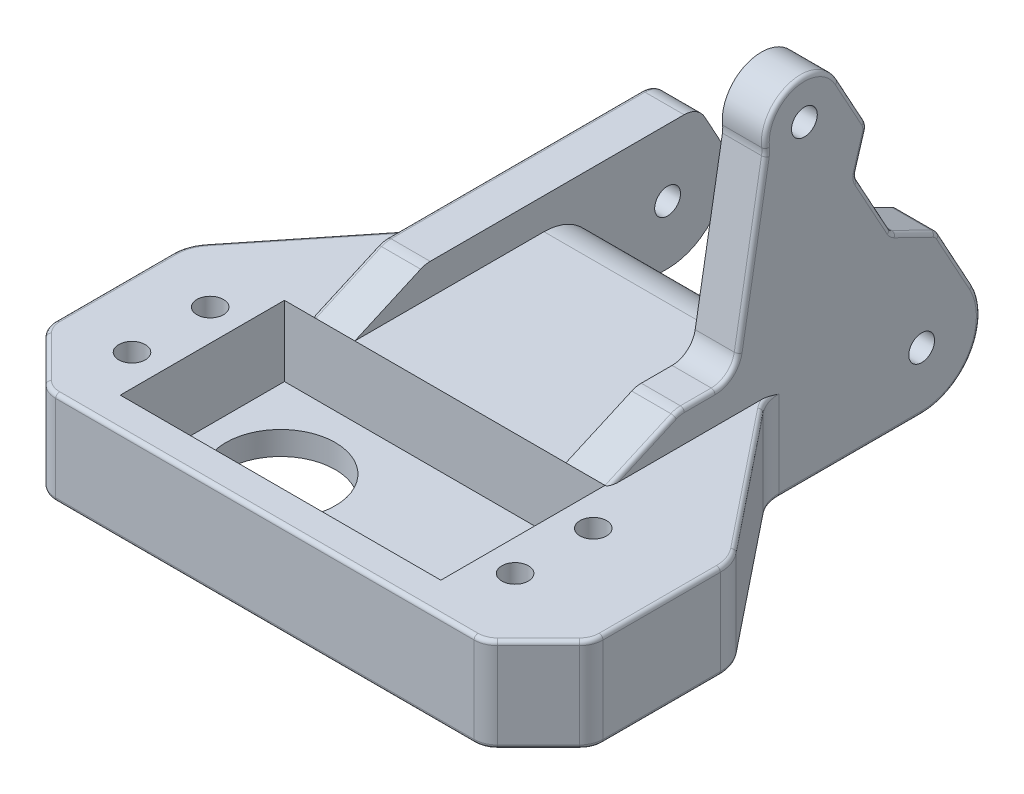
from build123d import *

# Parameters (mm, degrees)
SKETCH1_R           = 7.5
SKETCH1_R_2         = 1.65
SKETCH1_R_3         = 5
BOSS_EXTRUDE1_DEPTH = 2.75
CUT_EXTRUDE1_DEPTH  = 10
FILLET3_R           = 1.5
EXTRUDE_1_DEPTH     = 27
SKETCH_4_R          = 1.65
EXTRUDE_2_DEPTH     = 5.5
FILLET_1_R          = 3
EXTRUDE_3_DEPTH     = 12
SKETCH_6_R          = 1.65
SKETCH_6_R_2        = 7
CUT_EXTRUDE_1_DEPTH = 10
SKETCH_7_R          = 1.7
SKETCH_7_W          = 41
SKETCH_7_H          = 21
CUT_EXTRUDE_2_DEPTH = 9
SKETCH_9_R          = 3
CUT_EXTRUDE_3_DEPTH = 1.5
SKETCH_11_R         = 3.5
CUT_EXTRUDE_4_DEPTH = 5
FILLET_2_R          = 5
CHAMFER_1_SIZE      = 7
FILLET_3_R          = 3
FILLET_4_R          = 0.5


with BuildPart() as part:
    # Sketch1 → Boss-Extrude1 (new, symmetric)
    # profile 1 of 3: a face of its own
    with BuildSketch(Plane(origin=(0, 0, 0), x_dir=(0, 0, -1), z_dir=(1, 0, 0))):
        with BuildLine():
            Line((-40, -7.5), (0, -7.5))
            ThreePointArc((0, -7.5), (-6.454902502, 3.818930961), (6.573553871, 3.610871017))
            Line((6.573553871, 3.610871017), (-10.617630753, 34.907247345))
            ThreePointArc((-10.617630753, 34.907247345), (-10.15686846, 33.742608901), (-10, 32.5))
            ThreePointArc((-10, 32.5), (-14.49745519, 27.525319235), (-19.898979486, 31.5))
            Line((-19.898979486, 31.5), (-23.898979486, 8.5))
            Line((-23.898979486, 8.5), (-31, 8.5))
            Line((-31, 8.5), (-40, 4.5))
            Line((-40, 4.5), (-40, -7.5))
        make_face()
    # profile 2 of 3: a face of its own
    with BuildSketch(Plane(origin=(0, 0, 0), x_dir=(0, 0, -1), z_dir=(1, 0, 0))):
        Circle(SKETCH1_R)
        Circle(SKETCH1_R_2, mode=Mode.SUBTRACT)
    # profile 3 of 3: a face of its own
    with BuildSketch(Plane(origin=(0, 0, 0), x_dir=(0, 0, -1), z_dir=(1, 0, 0))):
        with Locations((-15, 32.5)):
            Circle(SKETCH1_R_3)
        with Locations((-15, 32.5)):
            Circle(SKETCH1_R_2, mode=Mode.SUBTRACT)
    extrude(amount=BOSS_EXTRUDE1_DEPTH, both=True)

    # Sketch2 → Cut-Extrude1 (cut)
    with BuildSketch(Plane(origin=(2.75, 0, 0), x_dir=(0, 0, -1), z_dir=(1, 0, 0))):
        Polygon((2.102708187, 11.75), (-3.740175524, 14.597930816), (-8.423675042, 23.124193935), (-6.90585641, 28.15), align=None)
    extrude(amount=-CUT_EXTRUDE1_DEPTH, mode=Mode.SUBTRACT)

    # Fillet3
    fillet3_edges = [part.edges().sort_by_distance(p)[0] for p in [
        (0, 28.15, 6.90585641),
        (0, 11.75, -2.102708187),
        (0, 14.597930816, 3.740175524),
        (0, 23.124193935, 8.423675042),
    ]]
    fillet(fillet3_edges, radius=FILLET3_R)

    # 草图2 → 凸台-拉伸1 (add)
    with BuildSketch(Plane.ZY.offset(2.75)):
        with BuildLine():
            Line((40, -7.5), (4.974937186, -7.5))
            ThreePointArc((4.974937186, -7.5), (7.572239412, -4.864276954), (8.889457854, -1.40625))
            ThreePointArc((8.889457854, -1.40625), (11.256847259, 2.822417214), (15.803480629, 4.5))
            Line((15.803480629, 4.5), (40, 4.5))
            Line((40, 4.5), (40, -7.5))
        make_face()
    extrude(amount=EXTRUDE_1_DEPTH)

    # 草图4 → 凸台-拉伸2 (add)
    with BuildSketch(Plane.ZY.offset(29.75)):
        with BuildLine():
            Line((31, 8.5), (-3.887942025, 8.5))
            Line((-3.887942025, 8.5), (-6.573553871, 3.610871017))
            ThreePointArc((-6.573553871, 3.610871017), (-6.454902502, -3.818930961), (0, -7.5))
            Line((0, -7.5), (40, -7.5))
            Line((40, -7.5), (40, 4.5))
            Line((40, 4.5), (31, 8.5))
        make_face()
        with Locations(Location((0, 0, 0), (0, 0, 180))):
            Circle(SKETCH_4_R, mode=Mode.SUBTRACT)
    extrude(amount=EXTRUDE_2_DEPTH)

    # 圆角1
    fillet_1_edges = [part.edges().sort_by_distance(p)[0] for p in [
        (-32.5, 8.5, 31),
        (-32.5, 8.5, -3.887942025),
        (0, 8.5, 31),
        (0, 8.5, 23.898979486),
        (0, 31.5, 19.898979486),
    ]]
    fillet(fillet_1_edges, radius=FILLET_1_R)

    # 草图5 → 凸台-拉伸3 (add)
    with BuildSketch(Plane.XZ.offset(7.5)):
        Polygon((2.75, 20), (18.75, 40), (18.75, 65), (-51.25, 65), (-51.25, 40), (-35.25, 20), align=None)
    extrude(amount=-EXTRUDE_3_DEPTH)

    # 草图6 → 切除-拉伸1 (cut)
    with BuildSketch(Plane.XZ.offset(7.5)):
        with Locations(Location((-3.75, 50.5, 0), (0, 0, 270))):
            Circle(SKETCH_6_R)
        with Locations(Location((-28.75, 50.5, 0), (0, 0, 270))):
            Circle(SKETCH_6_R_2)
    extrude(amount=-CUT_EXTRUDE_1_DEPTH, mode=Mode.SUBTRACT)

    # 草图7 → 切除-拉伸2 (cut)
    with BuildSketch(Plane(origin=(0, 4.5, 0), x_dir=(1, 0, 0), z_dir=(0, 1, 0))):
        with Locations(Location((-42.75, -45.5, 0), (0, 0, 270))):
            Circle(SKETCH_7_R)
        with Locations(Location((-42.75, -55.5, 0), (0, 0, 270))):
            Circle(SKETCH_7_R)
        with Locations(Location((6.25, -45.5, 0), (0, 0, 270))):
            Circle(SKETCH_7_R)
        with Locations(Location((6.25, -55.5, 0), (0, 0, 270))):
            Circle(SKETCH_7_R)
        with Locations((-18.25, -50.5)):
            Rectangle(SKETCH_7_W, SKETCH_7_H)
    extrude(amount=-CUT_EXTRUDE_2_DEPTH, mode=Mode.SUBTRACT)

    # 草图9 → 切除-拉伸3 (cut)
    with BuildSketch(Plane(origin=(0, -4.5, 0), x_dir=(1, 0, 0), z_dir=(0, 1, 0))):
        with Locations(Location((-3.75, -50.5, 0), (0, 0, 270))):
            Circle(SKETCH_9_R)
    extrude(amount=-CUT_EXTRUDE_3_DEPTH, mode=Mode.SUBTRACT)

    # 草图11 → 切除-拉伸4 (cut)
    with BuildSketch(Plane.XZ.offset(7.5)):
        with Locations(Location((-42.75, 55.5, 0), (0, 0, 270))):
            Circle(SKETCH_11_R)
        with Locations(Location((-42.75, 45.5, 0), (0, 0, 270))):
            Circle(SKETCH_11_R)
        with Locations(Location((6.25, 55.5, 0), (0, 0, 270))):
            Circle(SKETCH_11_R)
        with Locations(Location((6.25, 45.5, 0), (0, 0, 270))):
            Circle(SKETCH_11_R)
    extrude(amount=-CUT_EXTRUDE_4_DEPTH, mode=Mode.SUBTRACT)

    # 圆角2
    fillet_2_edges = [part.edges().sort_by_distance(p)[0] for p in [
        (2.75, -1.5, 20),
        (-35.25, -1.5, 20),
        (-51.25, -1.5, 40),
        (18.75, -1.5, 40),
    ]]
    fillet(fillet_2_edges, radius=FILLET_2_R)

    # 倒角1
    chamfer_1_edges = [part.edges().sort_by_distance(p)[0] for p in [
        (-51.25, -1.5, 65),
        (18.75, -1.5, 65),
    ]]
    chamfer(chamfer_1_edges, length=CHAMFER_1_SIZE)

    # 圆角3
    fillet_3_edges = [part.edges().sort_by_distance(p)[0] for p in [
        (18.75, -1.5, 58),
        (-44.25, -1.5, 65),
        (11.75, -1.5, 65),
        (-51.25, -1.5, 58),
    ]]
    fillet(fillet_3_edges, radius=FILLET_3_R)

    # 圆角4
    # the kernel refuses this fillet: 0.5 mm, written as the material it takes off along each edge
    with BuildSketch(Plane(origin=(2.75, 32.5, 15), x_dir=(0, 0.4814494689878742, -0.8764738494737273), z_dir=(0, -0.8764738494737273, -0.4814494689878742))) as fillet_4_piece_1:
        with BuildLine():
            CenterArc((5 - FILLET_4_R, -FILLET_4_R), FILLET_4_R, 0, 90)
            Line((5, -FILLET_4_R), (5, 0))
            Line((5, 0), (5 - FILLET_4_R, 0))
        make_face()
    revolve(axis=Axis((2.75, 32.5, 15), (1, 0, 0)), revolution_arc=158.23726256, mode=Mode.SUBTRACT)
    with BuildSketch(Plane(origin=(-35.25, 8.5, 30.363356649), x_dir=(0, -1, 0), z_dir=(0, 0, -1))) as fillet_4_piece_2:
        with BuildLine():
            CenterArc((FILLET_4_R, -FILLET_4_R), FILLET_4_R, 90, 90)
            Line((0, -FILLET_4_R), (0, 0))
            Line((0, 0), (FILLET_4_R, 0))
        make_face()
    extrude(amount=32.476400776, mode=Mode.SUBTRACT)
    with BuildSketch(Plane(origin=(-35.25, 6.944348407, -4.742465676), x_dir=(0, -0.48144946898787383, 0.8764738494737276), z_dir=(0, -0.8764738494737275, -0.4814494689878738))) as fillet_4_piece_3:
        with BuildLine():
            CenterArc((FILLET_4_R, -FILLET_4_R), FILLET_4_R, 90, 90)
            Line((0, -FILLET_4_R), (0, 0))
            Line((0, 0), (FILLET_4_R, 0))
        make_face()
    extrude(amount=3.803282199, mode=Mode.SUBTRACT)
    with BuildSketch(Plane(origin=(-35.25, 5.5, -2.113044128), x_dir=(0, 1, 0), z_dir=(0, 0, 1))) as fillet_4_piece_4:
        with BuildLine():
            CenterArc((3 - FILLET_4_R, -FILLET_4_R), FILLET_4_R, 0, 90)
            Line((3, -FILLET_4_R), (3, 0))
            Line((3, 0), (3 - FILLET_4_R, 0))
        make_face()
    revolve(axis=Axis((-35.25, 5.5, -2.113044128), (-1, 0, 0)), revolution_arc=61.219888022, mode=Mode.SUBTRACT)
    with BuildSketch(Plane(origin=(-35.25, 5.5, 30.363356649), x_dir=(0, 1, 0), z_dir=(0, 0, -1))) as fillet_4_piece_5:
        with BuildLine():
            CenterArc((3 - FILLET_4_R, FILLET_4_R), FILLET_4_R, 270, 90)
            Line((3, FILLET_4_R), (3, 0))
            Line((3, 0), (3 - FILLET_4_R, 0))
        make_face()
    revolve(axis=Axis((-35.25, 5.5, 30.363356649), (1, 0, 0)), revolution_arc=23.962488975, mode=Mode.SUBTRACT)
    with BuildSketch(Plane(origin=(2.75, 8.5, 26.422271015), x_dir=(0, -1, 0), z_dir=(0, 0, 1))) as fillet_4_piece_6:
        with BuildLine():
            CenterArc((FILLET_4_R, -FILLET_4_R), FILLET_4_R, 90, 90)
            Line((0, -FILLET_4_R), (0, 0))
            Line((0, 0), (FILLET_4_R, 0))
        make_face()
    extrude(amount=3.941085634, mode=Mode.SUBTRACT)
    with BuildSketch(Plane(origin=(2.75, 31.008613913, 19.984437936), x_dir=(0, -0.1713411747512476, -0.9852117548196746), z_dir=(0, -0.9852117548196746, 0.17134117475124758))) as fillet_4_piece_7:
        with BuildLine():
            CenterArc((FILLET_4_R, -FILLET_4_R), FILLET_4_R, 90, 90)
            Line((0, -FILLET_4_R), (0, 0))
            Line((0, 0), (FILLET_4_R, 0))
        make_face()
    extrude(amount=20.32318163, mode=Mode.SUBTRACT)
    with BuildSketch(Plane(origin=(2.75, 5.5, 30.363356649), x_dir=(0, 0.9138115486202572, 0.4061384660534475), z_dir=(0, -0.4061384660534475, 0.9138115486202572))) as fillet_4_piece_8:
        with BuildLine():
            CenterArc((3 - FILLET_4_R, FILLET_4_R), FILLET_4_R, 270, 90)
            Line((3, FILLET_4_R), (3, 0))
            Line((3, 0), (3 - FILLET_4_R, 0))
        make_face()
    revolve(axis=Axis((2.75, 5.5, 30.363356649), (-1, 0, 0)), revolution_arc=23.962488975, mode=Mode.SUBTRACT)
    with BuildSketch(Plane(origin=(2.75, 11.5, 26.422271015), x_dir=(0, -1, 0), z_dir=(0, 0, 1))) as fillet_4_piece_9:
        with BuildLine():
            CenterArc((3 + FILLET_4_R, -FILLET_4_R), FILLET_4_R, 90, 90)
            Line((3, -FILLET_4_R), (3, 0))
            Line((3, 0), (3 + FILLET_4_R, 0))
        make_face()
    revolve(axis=Axis((2.75, 11.5, 26.422271015), (1, 0, 0)), revolution_arc=80.134193057, mode=Mode.SUBTRACT)
    with BuildSketch(Plane(origin=(2.75, 31.522637437, 22.9400732), x_dir=(0, -0.17134117475124813, -0.9852117548196744), z_dir=(0, -0.9852117548196744, 0.17134117475124813))) as fillet_4_piece_10:
        with BuildLine():
            CenterArc((3 + FILLET_4_R, -FILLET_4_R), FILLET_4_R, 90, 90)
            Line((3, -FILLET_4_R), (3, 0))
            Line((3, 0), (3 + FILLET_4_R, 0))
        make_face()
    revolve(axis=Axis((2.75, 31.522637437, 22.9400732), (1, 0, 0)), revolution_arc=16.883181481, mode=Mode.SUBTRACT)
    with BuildSketch(Plane(origin=(2.75, 8.241434646, 31.581772047), x_dir=(0, -0.9138115486202573, -0.40613846605344783), z_dir=(0, -0.4061384660534478, 0.913811548620257))) as fillet_4_piece_11_section:
        with BuildLine():
            CenterArc((FILLET_4_R, -FILLET_4_R), FILLET_4_R, 90, 90)
            Line((0, -FILLET_4_R), (0, 0))
            Line((0, 0), (FILLET_4_R, 0))
        make_face()
    fillet_4_piece_11 = extrude(amount=10.46221445, mode=Mode.PRIVATE)
    fillet_4_piece_11 = split(fillet_4_piece_11, bisect_by=Plane(origin=(2.665903112, 4.5, 31.925842247), z_dir=(0, 1, 0)), keep=Keep.TOP, mode=Mode.PRIVATE)
    add(fillet_4_piece_11, mode=Mode.SUBTRACT)
    with BuildSketch(Plane(origin=(3.845655953, 4.5, 21.369569941), x_dir=(-0.7808688094430303, 0, 0.6246950475544245), z_dir=(0.6246950475544245, 0, 0.7808688094430303)), Plane(origin=(-50.154344047, 4.5, 38.630430059), x_dir=(0.7808688094430304, 0, 0.6246950475544243), z_dir=(0.6246950475544243, 0, -0.7808688094430304))) as fillet_4_piece_12:
        with BuildLine():
            CenterArc((FILLET_4_R, FILLET_4_R), FILLET_4_R, 180, 90)
            Line((0, FILLET_4_R), (0, 0))
            Line((0, 0), (FILLET_4_R, 0))
        make_face()
    extrude(amount=22.104686356, mode=Mode.SUBTRACT)
    with BuildSketch(Plane(origin=(3.845655953, -7.5, 21.369569941), x_dir=(-0.7808688094430302, 0, 0.6246950475544245), z_dir=(0.6246950475544245, 0, 0.7808688094430303)), Plane(origin=(-50.154344047, -7.5, 38.630430059), x_dir=(0.7808688094430304, 0, 0.6246950475544243), z_dir=(0.6246950475544243, 0, -0.7808688094430304))) as fillet_4_piece_13:
        with BuildLine():
            CenterArc((FILLET_4_R, -FILLET_4_R), FILLET_4_R, 90, 90)
            Line((0, -FILLET_4_R), (0, 0))
            Line((0, 0), (FILLET_4_R, 0))
        make_face()
    extrude(amount=22.104686356, mode=Mode.SUBTRACT)
    with BuildSketch(Plane(origin=(18.75, -7.5, 41.753905297), x_dir=(-1, 0, 0), z_dir=(0, 0, 1)), Plane(origin=(-51.25, 4.5, 56.757359313), x_dir=(0, -1, 0), z_dir=(0, 0, -1))) as fillet_4_piece_14:
        with BuildLine():
            CenterArc((FILLET_4_R, -FILLET_4_R), FILLET_4_R, 90, 90)
            Line((0, -FILLET_4_R), (0, 0))
            Line((0, 0), (FILLET_4_R, 0))
        make_face()
    extrude(amount=15.003454016, mode=Mode.SUBTRACT)
    with BuildSketch(Plane(origin=(-46.25, -7.5, 41.753905297), x_dir=(-1, 0, 0), z_dir=(0, 0, 1))) as fillet_4_piece_15:
        with BuildLine():
            CenterArc((5 - FILLET_4_R, -FILLET_4_R), FILLET_4_R, 0, 90)
            Line((5, -FILLET_4_R), (5, 0))
            Line((5, 0), (5 - FILLET_4_R, 0))
        make_face()
    revolve(axis=Axis((-46.25, -7.5, 41.753905297), (0, -1, 0)), revolution_arc=38.659808254, mode=Mode.SUBTRACT)
    with BuildSketch(Plane(origin=(13.75, -7.5, 41.753905297), x_dir=(0.7808688094430305, 0, -0.6246950475544241), z_dir=(-0.6246950475544241, 0, -0.7808688094430305))) as fillet_4_piece_16:
        with BuildLine():
            CenterArc((5 - FILLET_4_R, -FILLET_4_R), FILLET_4_R, 360, 90)
            Line((5, -FILLET_4_R), (5, 0))
            Line((5, 0), (5 - FILLET_4_R, 0))
        make_face()
    revolve(axis=Axis((13.75, -7.5, 41.753905297), (0, -1, 0)), revolution_arc=38.659808254, mode=Mode.SUBTRACT)
    with BuildSketch(Plane(origin=(-46.25, 4.5, 41.753905297), x_dir=(-1, 0, 0), z_dir=(0, 0, 1))) as fillet_4_piece_17:
        with BuildLine():
            CenterArc((5 - FILLET_4_R, FILLET_4_R), FILLET_4_R, 270, 90)
            Line((5 - FILLET_4_R, 0), (5, 0))
            Line((5, 0), (5, FILLET_4_R))
        make_face()
    revolve(axis=Axis((-46.25, 4.5, 41.753905297), (0, -1, 0)), revolution_arc=38.659808254, mode=Mode.SUBTRACT)
    with BuildSketch(Plane(origin=(13.75, 4.5, 41.753905297), x_dir=(0.7808688094430307, 0, -0.6246950475544237), z_dir=(-0.6246950475544237, 0, -0.7808688094430307))) as fillet_4_piece_18:
        with BuildLine():
            CenterArc((5 - FILLET_4_R, FILLET_4_R), FILLET_4_R, 270, 90)
            Line((5, FILLET_4_R), (5, 0))
            Line((5, 0), (5 - FILLET_4_R, 0))
        make_face()
    revolve(axis=Axis((13.75, 4.5, 41.753905297), (0, -1, 0)), revolution_arc=38.659808254, mode=Mode.SUBTRACT)
    with BuildSketch(Plane(origin=(7.75, -7.5, 18.246094703), x_dir=(-1, 0, 0), z_dir=(0, 0, -1))) as fillet_4_piece_19:
        with BuildLine():
            CenterArc((5 + FILLET_4_R, FILLET_4_R), FILLET_4_R, 180, 90)
            Line((5, FILLET_4_R), (5, 0))
            Line((5, 0), (5 + FILLET_4_R, 0))
        make_face()
    revolve(axis=Axis((7.75, -7.5, 18.246094703), (0, 1, 0)), revolution_arc=38.659808254, mode=Mode.SUBTRACT)
    with BuildSketch(Plane(origin=(7.75, 4.5, 18.246094703), x_dir=(-0.968907838098559, 0, -0.2474219094404866), z_dir=(0.2474219094404866, 0, -0.968907838098559))) as fillet_4_piece_20_section:
        with BuildLine():
            CenterArc((5 + FILLET_4_R, -FILLET_4_R), FILLET_4_R, 90, 90)
            Line((5, -FILLET_4_R), (5, 0))
            Line((5, 0), (5 + FILLET_4_R, 0))
        make_face()
    fillet_4_piece_20 = revolve(axis=Axis((7.75, 4.5, 18.246094703), (0, 1, 0)), revolution_arc=52.984814603, mode=Mode.PRIVATE)
    fillet_4_piece_20 = split(fillet_4_piece_20, bisect_by=Plane(origin=(2.75, 4.355158309, 19.909083982), z_dir=(1, 0, 0)), keep=Keep.TOP, mode=Mode.PRIVATE)
    add(fillet_4_piece_20, mode=Mode.SUBTRACT)
    with BuildSketch(Plane(origin=(-40.25, -7.5, 18.246094703), x_dir=(0.7808688094430307, 0, 0.6246950475544237), z_dir=(-0.6246950475544237, 0, 0.7808688094430307))) as fillet_4_piece_21:
        with BuildLine():
            CenterArc((5 + FILLET_4_R, FILLET_4_R), FILLET_4_R, 180, 90)
            Line((5, FILLET_4_R), (5, 0))
            Line((5, 0), (5 + FILLET_4_R, 0))
        make_face()
    revolve(axis=Axis((-40.25, -7.5, 18.246094703), (0, 1, 0)), revolution_arc=38.659808254, mode=Mode.SUBTRACT)
    with BuildSketch(Plane(origin=(-40.25, 4.5, 18.246094703), x_dir=(0.7808688094430299, 0, 0.624695047554425), z_dir=(-0.624695047554425, 0, 0.7808688094430299))) as fillet_4_piece_22_section:
        with BuildLine():
            CenterArc((5 + FILLET_4_R, -FILLET_4_R), FILLET_4_R, 90, 90)
            Line((5, -FILLET_4_R), (5, 0))
            Line((5, 0), (5 + FILLET_4_R, 0))
        make_face()
    fillet_4_piece_22 = revolve(axis=Axis((-40.25, 4.5, 18.246094703), (0, 1, 0)), revolution_arc=52.984814603, mode=Mode.PRIVATE)
    fillet_4_piece_22 = split(fillet_4_piece_22, bisect_by=Plane(origin=(-35.25, 4.415764443, 20.981944608), z_dir=(-1, 0, 0)), keep=Keep.TOP, mode=Mode.PRIVATE)
    add(fillet_4_piece_22, mode=Mode.SUBTRACT)
    with BuildSketch(Plane(origin=(2.75, -7.5, 18.246094703), x_dir=(-1, 0, 0), z_dir=(0, 0, -1)), Plane(origin=(-35.25, -7.5, 0), x_dir=(1, 0, 0), z_dir=(0, 0, 1))) as fillet_4_piece_23:
        with BuildLine():
            CenterArc((FILLET_4_R, FILLET_4_R), FILLET_4_R, 180, 90)
            Line((0, FILLET_4_R), (0, 0))
            Line((0, 0), (FILLET_4_R, 0))
        make_face()
    extrude(amount=18.246094703, mode=Mode.SUBTRACT)
    with BuildSketch(Plane(origin=(-51.25, -7.5, 56.757359313), x_dir=(0, 1, 0), z_dir=(0, 0, -1)), Plane(origin=(18.75, 4.5, 41.753905297), x_dir=(-1, 0, 0), z_dir=(0, 0, 1))) as fillet_4_piece_24:
        with BuildLine():
            CenterArc((FILLET_4_R, FILLET_4_R), FILLET_4_R, 180, 90)
            Line((0, FILLET_4_R), (0, 0))
            Line((0, 0), (FILLET_4_R, 0))
        make_face()
    extrude(amount=15.003454016, mode=Mode.SUBTRACT)
    with BuildSketch(Plane(origin=(10.507359313, 4.5, 65), x_dir=(0, 0, -1), z_dir=(-1, 0, 0))) as fillet_4_piece_25:
        with BuildLine():
            CenterArc((FILLET_4_R, FILLET_4_R), FILLET_4_R, 180, 90)
            Line((0, FILLET_4_R), (0, 0))
            Line((0, 0), (FILLET_4_R, 0))
        make_face()
    extrude(amount=53.514718626, mode=Mode.SUBTRACT)
    with BuildSketch(Plane(origin=(12.628679656, 4.5, 64.121320344), x_dir=(-0.7071067811865474, 0, -0.7071067811865478), z_dir=(0.7071067811865478, 0, -0.7071067811865474)), Plane(origin=(-50.371320344, 4.5, 58.878679656), x_dir=(0.7071067811865476, -3.5527136788004725e-15, -0.7071067811865476), z_dir=(0.7071067811865476, 0, 0.7071067811865476))) as fillet_4_piece_26:
        with BuildLine():
            CenterArc((FILLET_4_R, -FILLET_4_R), FILLET_4_R, 90, 90)
            Line((0, -FILLET_4_R), (0, 0))
            Line((0, 0), (FILLET_4_R, 0))
        make_face()
    extrude(amount=7.414213562, mode=Mode.SUBTRACT)
    with BuildSketch(Plane(origin=(10.507359313, 4.5, 62), x_dir=(0.7071067811865476, 0, 0.7071067811865476), z_dir=(0.7071067811865476, 0, -0.7071067811865476))) as fillet_4_piece_27:
        with BuildLine():
            CenterArc((3 - FILLET_4_R, FILLET_4_R), FILLET_4_R, 270, 90)
            Line((3, FILLET_4_R), (3, 0))
            Line((3, 0), (3 - FILLET_4_R, 0))
        make_face()
    revolve(axis=Axis((10.507359313, 4.5, 62), (0, -1, 0)), revolution_arc=45, mode=Mode.SUBTRACT)
    with BuildSketch(Plane(origin=(15.75, 4.5, 56.757359313), x_dir=(1, 0, 0), z_dir=(0, 0, -1))) as fillet_4_piece_28:
        with BuildLine():
            CenterArc((3 - FILLET_4_R, FILLET_4_R), FILLET_4_R, 270, 90)
            Line((3, FILLET_4_R), (3, 0))
            Line((3, 0), (3 - FILLET_4_R, 0))
        make_face()
    revolve(axis=Axis((15.75, 4.5, 56.757359313), (0, -1, 0)), revolution_arc=45, mode=Mode.SUBTRACT)
    with BuildSketch(Plane(origin=(-43.007359313, 4.5, 62), x_dir=(-0.7071067811865464, 0, 0.7071067811865487), z_dir=(-0.7071067811865487, 0, -0.7071067811865464))) as fillet_4_piece_29:
        with BuildLine():
            CenterArc((3 - FILLET_4_R, -FILLET_4_R), FILLET_4_R, 0, 90)
            Line((3, -FILLET_4_R), (3, 0))
            Line((3, 0), (3 - FILLET_4_R, 0))
        make_face()
    revolve(axis=Axis((-43.007359313, 4.5, 62), (0, 1, 0)), revolution_arc=45, mode=Mode.SUBTRACT)
    with BuildSketch(Plane(origin=(-48.25, 4.5, 56.757359313), x_dir=(-1, 0, 0), z_dir=(0, 0, -1))) as fillet_4_piece_30:
        with BuildLine():
            CenterArc((3 - FILLET_4_R, -FILLET_4_R), FILLET_4_R, 0, 90)
            Line((3 - FILLET_4_R, 0), (3, 0))
            Line((3, 0), (3, -FILLET_4_R))
        make_face()
    revolve(axis=Axis((-48.25, 4.5, 56.757359313), (0, 1, 0)), revolution_arc=45, mode=Mode.SUBTRACT)
    with BuildSketch(Plane(origin=(-50.371320344, -7.5, 58.878679656), x_dir=(0.7071067811865476, 0, -0.7071067811865476), z_dir=(0.7071067811865476, 0, 0.7071067811865476)), Plane(origin=(12.628679656, -7.5, 64.121320344), x_dir=(-0.7071067811865472, 0, -0.7071067811865477), z_dir=(0.7071067811865478, 0, -0.7071067811865474))) as fillet_4_piece_31:
        with BuildLine():
            CenterArc((FILLET_4_R, FILLET_4_R), FILLET_4_R, 180, 90)
            Line((0, FILLET_4_R), (0, 0))
            Line((0, 0), (FILLET_4_R, 0))
        make_face()
    extrude(amount=7.414213562, mode=Mode.SUBTRACT)
    with BuildSketch(Plane(origin=(10.507359313, -7.5, 65), x_dir=(0, 0, -1), z_dir=(-1, 0, 0))) as fillet_4_piece_32:
        with BuildLine():
            CenterArc((FILLET_4_R, -FILLET_4_R), FILLET_4_R, 90, 90)
            Line((0, -FILLET_4_R), (0, 0))
            Line((0, 0), (FILLET_4_R, 0))
        make_face()
    extrude(amount=53.514718626, mode=Mode.SUBTRACT)
    with BuildSketch(Plane(origin=(10.507359313, -7.5, 62), x_dir=(0.707106781186547, 0, 0.7071067811865482), z_dir=(0.7071067811865482, 0, -0.707106781186547))) as fillet_4_piece_33:
        with BuildLine():
            CenterArc((3 - FILLET_4_R, -FILLET_4_R), FILLET_4_R, 0, 90)
            Line((3, -FILLET_4_R), (3, 0))
            Line((3, 0), (3 - FILLET_4_R, 0))
        make_face()
    revolve(axis=Axis((10.507359313, -7.5, 62), (0, -1, 0)), revolution_arc=45, mode=Mode.SUBTRACT)
    with BuildSketch(Plane(origin=(15.75, -7.5, 56.757359313), x_dir=(1, 0, 0), z_dir=(0, 0, -1))) as fillet_4_piece_34:
        with BuildLine():
            CenterArc((3 - FILLET_4_R, -FILLET_4_R), FILLET_4_R, 0, 90)
            Line((3, -FILLET_4_R), (3, 0))
            Line((3, 0), (3 - FILLET_4_R, 0))
        make_face()
    revolve(axis=Axis((15.75, -7.5, 56.757359313), (0, -1, 0)), revolution_arc=45, mode=Mode.SUBTRACT)
    with BuildSketch(Plane(origin=(-43.007359313, -7.5, 62), x_dir=(-0.7071067811865476, 0, 0.7071067811865476), z_dir=(-0.7071067811865476, 0, -0.7071067811865476))) as fillet_4_piece_35:
        with BuildLine():
            CenterArc((3 - FILLET_4_R, FILLET_4_R), FILLET_4_R, 270, 90)
            Line((3, FILLET_4_R), (3, 0))
            Line((3, 0), (3 - FILLET_4_R, 0))
        make_face()
    revolve(axis=Axis((-43.007359313, -7.5, 62), (0, 1, 0)), revolution_arc=45, mode=Mode.SUBTRACT)
    with BuildSketch(Plane(origin=(-48.25, -7.5, 56.757359313), x_dir=(-1, 0, 0), z_dir=(0, 0, -1))) as fillet_4_piece_36:
        with BuildLine():
            CenterArc((3 - FILLET_4_R, FILLET_4_R), FILLET_4_R, 270, 90)
            Line((3, FILLET_4_R), (3, 0))
            Line((3, 0), (3 - FILLET_4_R, 0))
        make_face()
    revolve(axis=Axis((-48.25, -7.5, 56.757359313), (0, 1, 0)), revolution_arc=45, mode=Mode.SUBTRACT)
    with BuildSketch(Plane(origin=(2.75, 0, 0), x_dir=(0, 0.4814494689878744, -0.8764738494737272), z_dir=(0, 0.8764738494737272, 0.4814494689878744))) as fillet_4_piece_37:
        with BuildLine():
            CenterArc((7.5 - FILLET_4_R, FILLET_4_R), FILLET_4_R, 270, 90)
            Line((7.5, FILLET_4_R), (7.5, 0))
            Line((7.5, 0), (7.5 - FILLET_4_R, 0))
        make_face()
    revolve(axis=Axis((2.75, 0, 0), (-1, 0, 0)), revolution_arc=118.780111978, mode=Mode.SUBTRACT)
    with BuildSketch(Plane(origin=(2.75, 3.610871017, -6.573553871), x_dir=(0, -0.4814494689878743, 0.8764738494737274), z_dir=(0, 0.8764738494737274, 0.4814494689878743))) as fillet_4_piece_38:
        with BuildLine():
            CenterArc((FILLET_4_R, -FILLET_4_R), FILLET_4_R, 90, 90)
            Line((0, -FILLET_4_R), (0, 0))
            Line((0, 0), (FILLET_4_R, 0))
        make_face()
    extrude(amount=8.809896049, mode=Mode.SUBTRACT)
    with BuildSketch(Plane(origin=(2.75, 11.958698097, -1.674538126), x_dir=(0, -0.8989051864283686, 0.43814320240325516), z_dir=(0, 0.43814320240325527, 0.8989051864283687))) as fillet_4_piece_39:
        with BuildLine():
            CenterArc((FILLET_4_R, -FILLET_4_R), FILLET_4_R, 90, 90)
            Line((0, -FILLET_4_R), (0, 0))
            Line((0, 0), (FILLET_4_R, 0))
        make_face()
    extrude(amount=5.547352116, mode=Mode.SUBTRACT)
    with BuildSketch(Plane(origin=(2.75, 15.015416295, 3.969501433), x_dir=(0, -0.48144946898787416, 0.8764738494737273), z_dir=(0, 0.8764738494737274, 0.4814494689878742))) as fillet_4_piece_40:
        with BuildLine():
            CenterArc((FILLET_4_R, -FILLET_4_R), FILLET_4_R, 90, 90)
            Line((0, -FILLET_4_R), (0, 0))
            Line((0, 0), (FILLET_4_R, 0))
        make_face()
    extrude(amount=8.621284918, mode=Mode.SUBTRACT)
    with BuildSketch(Plane(origin=(2.75, 23.727583743, 8.241448295), x_dir=(0, 0.28910831078003235, 0.957296393306648), z_dir=(0, 0.957296393306648, -0.2891083107800323))) as fillet_4_piece_41:
        with BuildLine():
            CenterArc((FILLET_4_R, -FILLET_4_R), FILLET_4_R, 90, 90)
            Line((0, -FILLET_4_R), (0, 0))
            Line((0, 0), (FILLET_4_R, 0))
        make_face()
    extrude(amount=3.989387691, mode=Mode.SUBTRACT)
    with BuildSketch(Plane(origin=(2.75, 27.980272658, 8.524027748), x_dir=(0, 0.48144946898787566, -0.8764738494737264), z_dir=(0, 0.8764738494737264, 0.48144946898787566))) as fillet_4_piece_42:
        with BuildLine():
            CenterArc((1.5 - FILLET_4_R, FILLET_4_R), FILLET_4_R, 270, 90)
            Line((1.5, FILLET_4_R), (1.5, 0))
            Line((1.5, 0), (1.5 - FILLET_4_R, 0))
        make_face()
    revolve(axis=Axis((2.75, 27.980272658, 8.524027748), (-1, 0, 0)), revolution_arc=45.584691403, mode=Mode.SUBTRACT)
    with BuildSketch(Plane(origin=(2.75, 10.610340318, -1.017323322), x_dir=(0, 0.4814494689878744, -0.8764738494737271), z_dir=(0, -0.8764738494737271, -0.4814494689878744))) as fillet_4_piece_43:
        with BuildLine():
            CenterArc((1.5 - FILLET_4_R, -FILLET_4_R), FILLET_4_R, 0, 90)
            Line((1.5, -FILLET_4_R), (1.5, 0))
            Line((1.5, 0), (1.5 - FILLET_4_R, 0))
        make_face()
    revolve(axis=Axis((2.75, 10.610340318, -1.017323322), (1, 0, 0)), revolution_arc=35.234417985, mode=Mode.SUBTRACT)
    with BuildSketch(Plane(origin=(2.75, 28.702446861, 7.209316974), x_dir=(0, -0.4814494689878742, 0.8764738494737274), z_dir=(0, 0.8764738494737274, 0.4814494689878743))) as fillet_4_piece_44:
        with BuildLine():
            CenterArc((FILLET_4_R, -FILLET_4_R), FILLET_4_R, 90, 90)
            Line((0, -FILLET_4_R), (0, 0))
            Line((0, 0), (FILLET_4_R, 0))
        make_face()
    extrude(amount=7.079276224, mode=Mode.SUBTRACT)
    with BuildSketch(Plane(origin=(2.75, 15.737590498, 2.654790659), x_dir=(0, -0.48144946898787455, 0.8764738494737272), z_dir=(0, 0.8764738494737272, 0.48144946898787455))) as fillet_4_piece_45:
        with BuildLine():
            CenterArc((1.5 + FILLET_4_R, -FILLET_4_R), FILLET_4_R, 90, 90)
            Line((1.5, -FILLET_4_R), (1.5, 0))
            Line((1.5, 0), (1.5 + FILLET_4_R, 0))
        make_face()
    revolve(axis=Axis((2.75, 15.737590498, 2.654790659), (1, 0, 0)), revolution_arc=35.234417985, mode=Mode.SUBTRACT)
    with BuildSketch(Plane(origin=(2.75, 23.293921277, 6.805503705), x_dir=(0, 0.28910831078003224, 0.957296393306648), z_dir=(0, 0.957296393306648, -0.28910831078003224))) as fillet_4_piece_46:
        with BuildLine():
            CenterArc((1.5 + FILLET_4_R, -FILLET_4_R), FILLET_4_R, 90, 90)
            Line((1.5, -FILLET_4_R), (1.5, 0))
            Line((1.5, 0), (1.5 + FILLET_4_R, 0))
        make_face()
    revolve(axis=Axis((2.75, 23.293921277, 6.805503705), (1, 0, 0)), revolution_arc=45.584691403, mode=Mode.SUBTRACT)
    with BuildSketch(Plane(origin=(-35.25, 0, 0), x_dir=(0, 0.48144946898787383, -0.8764738494737274), z_dir=(0, 0.8764738494737274, 0.48144946898787383))) as fillet_4_piece_47:
        with BuildLine():
            CenterArc((7.5 - FILLET_4_R, -FILLET_4_R), FILLET_4_R, 0, 90)
            Line((7.5 - FILLET_4_R, 0), (7.5, 0))
            Line((7.5, 0), (7.5, -FILLET_4_R))
        make_face()
    revolve(axis=Axis((-35.25, 0, 0), (-1, 0, 0)), revolution_arc=118.780111978, mode=Mode.SUBTRACT)
    with BuildSketch(Plane(origin=(-35.25, 3.992326917, 41.142264436), x_dir=(0, -0.913811548620257, -0.40613846605344783), z_dir=(0, 0.4061384660534478, -0.913811548620257))) as fillet_4_piece_48_section:
        with BuildLine():
            CenterArc((FILLET_4_R, -FILLET_4_R), FILLET_4_R, 90, 90)
            Line((0, -FILLET_4_R), (0, 0))
            Line((0, 0), (FILLET_4_R, 0))
        make_face()
    fillet_4_piece_48 = extrude(amount=10.46221445, mode=Mode.PRIVATE)
    fillet_4_piece_48 = split(fillet_4_piece_48, bisect_by=Plane(origin=(-35.134459917, 4.5, 35.962205532), z_dir=(0, 1, 0)), keep=Keep.TOP, mode=Mode.PRIVATE)
    add(fillet_4_piece_48, mode=Mode.SUBTRACT)


solid = part.part
